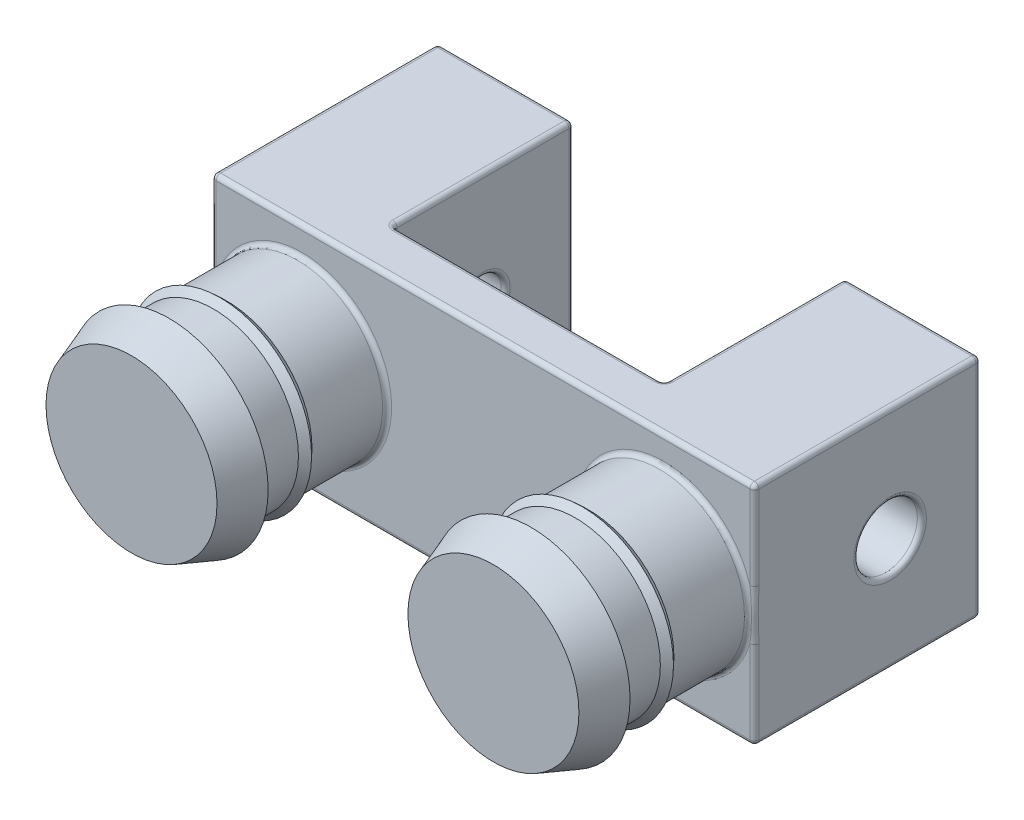
from build123d import *

# Parameters (mm, degrees)
BOSS_EXTRUDE1_DEPTH = 25
SKETCH2_R           = 2.5
CUT_EXTRUDE1_DEPTH  = 76
SKETCH6_W           = 9.4
SKETCH6_H           = 6.5
SKETCH6_H_2         = 4.9
SKETCH6_H_3         = 0.75
SKETCH6_H_4         = 1.8
FILLET2_R           = 0.5
FILLET3_R           = 0.5
FILLET4_R           = 0.5
CUT_EXTRUDE2_DEPTH  = 10
SKETCH10_R          = 3.5
CUT_EXTRUDE3_DEPTH  = 10
FILLET5_R           = 0.5


with BuildPart() as part:
    # Sketch1 → Boss-Extrude1 (new body)
    with BuildSketch(Plane(origin=(0, 0, 0), x_dir=(1, 0, 0), z_dir=(0, 1, 0))):
        Polygon((-30, 12.5), (-30, -12.5), (30, -12.5), (30, 12.5), (15, 12.5), (15, -7.5), (-15, -7.5), (-15, 12.5), align=None)
    extrude(amount=BOSS_EXTRUDE1_DEPTH)

    # Sketch2 → Cut-Extrude1 (cut)
    with BuildSketch(Plane.ZY.offset(30)):
        with Locations((-2.5, 12.5)):
            Circle(SKETCH2_R)
    extrude(amount=-CUT_EXTRUDE1_DEPTH, mode=Mode.SUBTRACT)

    # Sketch6 → Revolve1 (revolve)
    with BuildSketch(Plane(origin=(0, 25, 0), x_dir=(1, 0, 0), z_dir=(0, 1, 0))):
        with Locations((-20.3, -17.55)):
            Rectangle(SKETCH6_W, SKETCH6_H)
        with Locations((-20.3, -24.75)):
            Rectangle(SKETCH6_W, SKETCH6_H_2)
        Polygon((-14.05, -27.2), (-15.55, -31.35), (-25, -31.35), (-25, -27.2), align=None)
        with Locations((-20.3, -21.175)):
            Rectangle(SKETCH6_W, SKETCH6_H_3)
        with Locations((-20.3, -21.925)):
            Rectangle(SKETCH6_W, SKETCH6_H_3)
        Polygon((-15.6, -22.3), (-14.9, -21.55), (-15.6, -21.55), align=None)
        Polygon((-14.9, -21.55), (-15.6, -20.8), (-15.6, -21.55), align=None)
        with Locations((-20.3, -13.4)):
            Rectangle(SKETCH6_W, SKETCH6_H_4)
    revolve(axis=Axis((-25, 25, 20.8), (0, 0, -1)))


with BuildPart() as body_2:
    # Split1: read off the stored shape, not the designer's step
    # Split1: the piece on the far side of the plane
    add(part.part)
    split(bisect_by=Plane.XY.offset(12.5), keep=Keep.BOTTOM)


with BuildPart() as part_1:
    add(part.part)

    # Split1
    split(bisect_by=Plane.XY.offset(12.5), keep=Keep.TOP)


with BuildPart() as part_2:
    # Body-Move/Copy1: moved
    add(part_1.part.moved(Location((0, -10, 0))))


with BuildPart() as body_3:
    # Body-Move/Copy2: copy of part
    add(part_2.part.moved(Location((30, 0, 0))))


with BuildPart() as body_3_1:
    # Body-Move/Copy3: read off the stored shape, not the designer's step
    # Body-Move/Copy3: moved
    add(body_3.part.moved(Location((15, -2.5, 0))))


with BuildPart() as part_3:
    # Body-Move/Copy4: read off the stored shape, not the designer's step
    # Body-Move/Copy4: moved
    add(part_2.part.moved(Location((5, -2.5, 0))))


with BuildPart() as body_3_2:
    add(body_3_1.part)

    # Combine1: union body 2, part
    add(body_2.part)
    add(part_3.part)

    # Fillet2
    fillet2_edges = [body_3_2.edges().sort_by_distance(p)[0] for p in [
        (10.6, 12.5, 12.5),
    ]]
    fillet(fillet2_edges, radius=FILLET2_R)

    # Fillet3
    fillet3_edges = [body_3_2.edges().sort_by_distance(p)[0] for p in [
        (22.5, 25, -12.5),
        (30, 12.5, -12.5),
        (30, 12.5, -5),
        (30, 0, 0),
        (30, 12.5, 12.5),
        (-15, 12.5, -5),
        (-15, 0, -2.5),
        (-15, 12.5, 7.5),
        (0, 25, 7.5),
        (15, 12.5, 7.5),
        (15, 25, -2.5),
        (15, 12.5, -12.5),
        (-22.5, 25, -12.5),
        (-15, 12.5, -12.5),
        (-15, 25, -2.5),
        (0, 25, 12.5),
        (30, 25, 0),
        (15, 0, -2.5),
        (22.5, 0, -12.5),
        (-30, 0, 0),
        (-22.5, 0, -12.5),
        (0, 0, 7.5),
        (-30, 12.5, -5),
        (-30, 25, 0),
        (-30, 12.5, -12.5),
        (-30, 12.5, 12.5),
        (0, 0, 12.5),
    ]]
    fillet(fillet3_edges, radius=FILLET3_R)

    # Fillet4
    fillet4_edges = [body_3_2.edges().sort_by_distance(p)[0] for p in [
        (-29.4, 12.5, 12.5),
    ]]
    fillet(fillet4_edges, radius=FILLET4_R)

    # Sketch9 → Cut-Extrude2 (cut)
    with BuildSketch(Plane.ZY.offset(30)):
        Polygon((2.696152423, 12.5), (0.098076211, 17), (-5.098076211, 17), (-7.696152423, 12.5), (-5.098076211, 8), (0.098076211, 8), align=None)
    extrude(amount=-CUT_EXTRUDE2_DEPTH, mode=Mode.SUBTRACT)

    # Sketch10 → Cut-Extrude3 (cut)
    with BuildSketch(Plane(origin=(30, 0, 0), x_dir=(0, 0, -1), z_dir=(1, 0, 0))):
        with Locations((2.5, 12.5)):
            Circle(SKETCH10_R)
    extrude(amount=-CUT_EXTRUDE3_DEPTH, mode=Mode.SUBTRACT)

    # Fillet5
    fillet5_edges = [body_3_2.edges().sort_by_distance(p)[0] for p in [
        (-30, 10.25, 1.397114317),
        (-30, 14.75, 1.397114317),
        (-30, 17, -2.5),
        (-30, 14.75, -6.397114317),
        (-30, 10.25, -6.397114317),
        (-30, 8, -2.5),
        (-20, 10.25, 1.397114317),
        (-20, 8, -2.5),
        (-20, 10.25, -6.397114317),
        (-20, 14.75, -6.397114317),
        (-20, 17, -2.5),
        (-20, 14.75, 1.397114317),
        (-20, 12.5, -5),
        (30, 12.5, 1),
        (15, 12.5, -5),
    ]]
    fillet(fillet5_edges, radius=FILLET5_R)


solid = body_3_2.part
